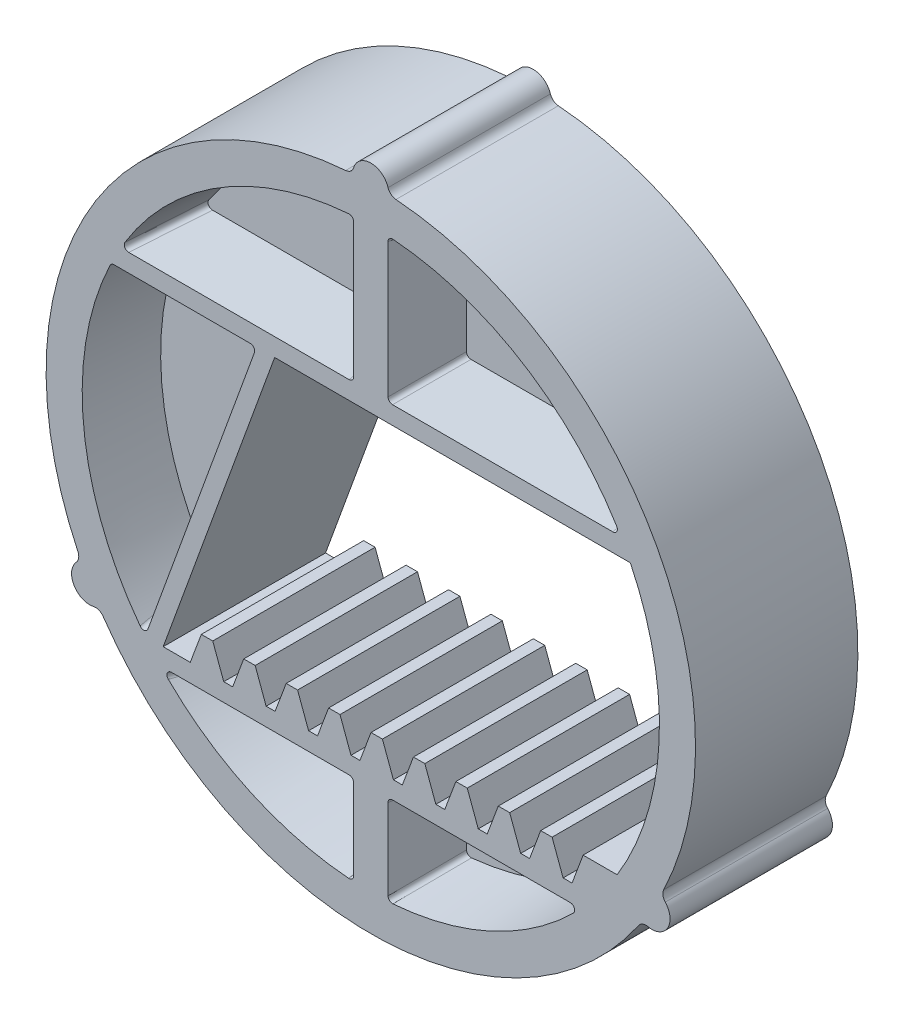
from build123d import *

# Parameters (mm, degrees)
BOSS_EXTRU_1_DEPTH                = 9
ENL_V_MAT_EXTRU_1_DEPTH           = 4
ENL_V_MAT_EXTRU_1_DRAFT           = -5
ENL_V_MAT_EXTRU_1_PROFILE_2_DEPTH = 4
ENL_V_MAT_EXTRU_1_PROFILE_2_DRAFT = -5
ENL_V_MAT_EXTRU_1_PROFILE_3_DEPTH = 4
ENL_V_MAT_EXTRU_1_PROFILE_3_DRAFT = -5
ENL_V_MAT_EXTRU_1_PROFILE_4_DEPTH = 4
ENL_V_MAT_EXTRU_1_PROFILE_4_DRAFT = -5
ENL_V_MAT_EXTRU_1_PROFILE_5_DEPTH = 4
ENL_V_MAT_EXTRU_1_PROFILE_5_DRAFT = -5
CONG_1_R                          = 0.25


with BuildPart() as part:
    # Esquisse1 → Boss.-Extru.1 (new body)
    with BuildSketch(Plane.XY):
        with BuildLine():
            ThreePointArc((-15.367509352, -9.975285609), (-15.074622025, -9.9973907), (-14.844683086, -10.180146564))
            ThreePointArc((-14.844683086, -10.180146564), (0, -18), (14.844683086, -10.180146564))
            ThreePointArc((14.844683086, -10.180146564), (15.074622025, -9.9973907), (15.367509352, -9.975285609))
            ThreePointArc((15.367509352, -9.975285609), (16.454482672, -9.5), (16.322605423, -8.321010688))
            ThreePointArc((16.322605423, -8.321010688), (16.19530533, -8.056310276), (16.238607082, -7.765799382))
            ThreePointArc((16.238607082, -7.765799382), (15.588457268, 9), (1.393923995, 17.945945946))
            ThreePointArc((1.393923995, 17.945945946), (1.120683305, 18.053700976), (0.955096071, 18.296296296))
            ThreePointArc((0.955096071, 18.296296296), (0, 19), (-0.955096071, 18.296296296))
            ThreePointArc((-0.955096071, 18.296296296), (-1.120683305, 18.053700976), (-1.393923995, 17.945945946))
            ThreePointArc((-1.393923995, 17.945945946), (-15.588457268, 9), (-16.238607082, -7.765799382))
            ThreePointArc((-16.238607082, -7.765799382), (-16.19530533, -8.056310276), (-16.322605423, -8.321010688))
            ThreePointArc((-16.322605423, -8.321010688), (-16.454482672, -9.5), (-15.367509352, -9.975285609))
        make_face()
        with BuildLine():
            Line((-5.331244604, 7), (14.38749457, 7))
            ThreePointArc((14.38749457, 7), (15.981739721, -0.764195974), (13.653943789, -8.340852415))
            Line((13.653943789, -8.340852415), (11.768206401, -8.340852415))
            Line((11.768206401, -8.340852415), (11.154006631, -9.990852415))
            Line((11.154006631, -9.990852415), (10.658353575, -9.990852415))
            Line((10.658353575, -9.990852415), (10.048820527, -8.33912277))
            Line((10.048820527, -8.33912277), (9.416678633, -8.33912277))
            Line((9.416678633, -8.33912277), (8.802478863, -9.98912277))
            Line((8.802478863, -9.98912277), (8.306825807, -9.98912277))
            Line((8.306825807, -9.98912277), (7.697292758, -8.337393125))
            Line((7.697292758, -8.337393125), (7.065150865, -8.337393125))
            Line((7.065150865, -8.337393125), (6.450951094, -9.987393125))
            Line((6.450951094, -9.987393125), (5.955298038, -9.987393125))
            Line((5.955298038, -9.987393125), (5.34576499, -8.33566348))
            Line((5.34576499, -8.33566348), (4.713623096, -8.33566348))
            Line((4.713623096, -8.33566348), (4.099423326, -9.98566348))
            Line((4.099423326, -9.98566348), (3.60377027, -9.98566348))
            Line((3.60377027, -9.98566348), (2.994237222, -8.333933835))
            Line((2.994237222, -8.333933835), (2.362095328, -8.333933835))
            Line((2.362095328, -8.333933835), (1.747895558, -9.983933835))
            Line((1.747895558, -9.983933835), (1.252242502, -9.983933835))
            Line((1.252242502, -9.983933835), (0.642709453, -8.332204189))
            Line((0.642709453, -8.332204189), (0.01056756, -8.332204189))
            Line((0.01056756, -8.332204189), (-0.603632211, -9.982204189))
            Line((-0.603632211, -9.982204189), (-1.099285266, -9.982204189))
            Line((-1.099285266, -9.982204189), (-1.708818315, -8.330474544))
            Line((-1.708818315, -8.330474544), (-2.340960209, -8.330474544))
            Line((-2.340960209, -8.330474544), (-2.955159979, -9.980474544))
            Line((-2.955159979, -9.980474544), (-3.450813035, -9.980474544))
            Line((-3.450813035, -9.980474544), (-4.060346083, -8.328744899))
            Line((-4.060346083, -8.328744899), (-4.692487977, -8.328744899))
            Line((-4.692487977, -8.328744899), (-5.306687747, -9.978744899))
            Line((-5.306687747, -9.978744899), (-5.802340803, -9.978744899))
            Line((-5.802340803, -9.978744899), (-6.411873851, -8.327015254))
            Line((-6.411873851, -8.327015254), (-7.044015745, -8.327015254))
            Line((-7.044015745, -8.327015254), (-7.658215515, -9.977015254))
            Line((-7.658215515, -9.977015254), (-8.153868571, -9.977015254))
            Line((-8.153868571, -9.977015254), (-8.76340162, -8.325285609))
            Line((-8.76340162, -8.325285609), (-9.395543513, -8.325285609))
            Line((-9.395543513, -8.325285609), (-10.009743284, -9.975285609))
            Line((-10.009743284, -9.975285609), (-11.509743284, -9.975285609))
            Line((-11.509743284, -9.975285609), (-5.331244604, 7))
        make_face(mode=Mode.SUBTRACT)
    extrude(amount=BOSS_EXTRU_1_DEPTH)


with BuildPart() as enl_v_mat_extru_1_tool:
    # Esquisse2 → Enlèv. mat.-Extru.1 (with draft: the straight prism first)
    with BuildSketch(Plane.XY.offset(9)):
        with BuildLine():
            Line((-6.331244604, 7), (-14.38749457, 7))
            ThreePointArc((-14.38749457, 7), (-15.903000705, -1.759138592), (-12.509743284, -9.975285609))
            Line((-12.509743284, -9.975285609), (-6.331244604, 7))
        make_face()
    extrude(amount=-ENL_V_MAT_EXTRU_1_DEPTH)
    # Enlèv. mat.-Extru.1: the draft: its side faces are tilted about the plane it starts from
    enl_v_mat_extru_1_sides = [enl_v_mat_extru_1_tool.faces().sort_by_distance(p)[0] for p in [
        (-9.420493944, -1.487642804, 7),
        (-10.359369587, 7, 7),
        (-15.903000705, -1.759138592, 7),
    ]]
    draft(enl_v_mat_extru_1_sides, Plane.XY.offset(9), ENL_V_MAT_EXTRU_1_DRAFT)


with BuildPart() as part_1:
    add(part.part)

    # Enlèv. mat.-Extru.1: cut by enl_v_mat_extru_1_tool
    add(enl_v_mat_extru_1_tool.part, mode=Mode.SUBTRACT)


with BuildPart() as enl_v_mat_extru_1_profile_2_tool:
    # Esquisse2 → Enlèv. mat.-Extru.1 profile 2 (with draft: the straight prism first)
    with BuildSketch(Plane.XY.offset(9)):
        with BuildLine():
            ThreePointArc((-0.955096071, 15.971468044), (-8.410185938, 13.611347196), (-13.856406461, 8))
            Line((-13.856406461, 8), (-0.955096071, 8))
            Line((-0.955096071, 8), (-0.955096071, 15.971468044))
        make_face()
    extrude(amount=-ENL_V_MAT_EXTRU_1_PROFILE_2_DEPTH)
    # Enlèv. mat.-Extru.1 profile 2: the draft: its side faces are tilted about the plane it starts from
    enl_v_mat_extru_1_profile_2_sides = [enl_v_mat_extru_1_profile_2_tool.faces().sort_by_distance(p)[0] for p in [
        (-8.410185938, 13.611347196, 7),
        (-7.405751266, 8, 7),
        (-0.955096071, 11.985734022, 7),
    ]]
    draft(enl_v_mat_extru_1_profile_2_sides, Plane.XY.offset(9), ENL_V_MAT_EXTRU_1_PROFILE_2_DRAFT)


with BuildPart() as part_2:
    add(part_1.part)

    # Enlèv. mat.-Extru.1 profile 2: cut by enl_v_mat_extru_1_profile_2_tool
    add(enl_v_mat_extru_1_profile_2_tool.part, mode=Mode.SUBTRACT)


with BuildPart() as enl_v_mat_extru_1_profile_3_tool:
    # Esquisse2 → Enlèv. mat.-Extru.1 profile 3 (with draft: the straight prism first)
    with BuildSketch(Plane.XY.offset(9)):
        with BuildLine():
            Line((0.955096071, 15.971468044), (0.955096071, 8))
            Line((0.955096071, 8), (13.856406461, 8))
            ThreePointArc((13.856406461, 8), (8.410185938, 13.611347196), (0.955096071, 15.971468044))
        make_face()
    extrude(amount=-ENL_V_MAT_EXTRU_1_PROFILE_3_DEPTH)
    # Enlèv. mat.-Extru.1 profile 3: the draft: its side faces are tilted about the plane it starts from
    enl_v_mat_extru_1_profile_3_sides = [enl_v_mat_extru_1_profile_3_tool.faces().sort_by_distance(p)[0] for p in [
        (0.955096071, 11.985734022, 7),
        (7.405751266, 8, 7),
        (8.410185938, 13.611347196, 7),
    ]]
    draft(enl_v_mat_extru_1_profile_3_sides, Plane.XY.offset(9), ENL_V_MAT_EXTRU_1_PROFILE_3_DRAFT)


with BuildPart() as part_3:
    add(part_2.part)

    # Enlèv. mat.-Extru.1 profile 3: cut by enl_v_mat_extru_1_profile_3_tool
    add(enl_v_mat_extru_1_profile_3_tool.part, mode=Mode.SUBTRACT)


with BuildPart() as enl_v_mat_extru_1_profile_4_tool:
    # Esquisse2 → Enlèv. mat.-Extru.1 profile 4 (with draft: the straight prism first)
    with BuildSketch(Plane.XY.offset(9)):
        with BuildLine():
            ThreePointArc((-11.642298133, -10.975285609), (-6.775990327, -14.494342175), (-0.955096071, -15.971468044))
            Line((-0.955096071, -15.971468044), (-0.955096071, -10.975285609))
            Line((-0.955096071, -10.975285609), (-11.642298133, -10.975285609))
        make_face()
    extrude(amount=-ENL_V_MAT_EXTRU_1_PROFILE_4_DEPTH)
    # Enlèv. mat.-Extru.1 profile 4: the draft: its side faces are tilted about the plane it starts from
    enl_v_mat_extru_1_profile_4_sides = [enl_v_mat_extru_1_profile_4_tool.faces().sort_by_distance(p)[0] for p in [
        (-6.775990327, -14.494342175, 7),
        (-0.955096071, -13.473376827, 7),
        (-6.298697102, -10.975285609, 7),
    ]]
    draft(enl_v_mat_extru_1_profile_4_sides, Plane.XY.offset(9), ENL_V_MAT_EXTRU_1_PROFILE_4_DRAFT)


with BuildPart() as part_4:
    add(part_3.part)

    # Enlèv. mat.-Extru.1 profile 4: cut by enl_v_mat_extru_1_profile_4_tool
    add(enl_v_mat_extru_1_profile_4_tool.part, mode=Mode.SUBTRACT)


with BuildPart() as enl_v_mat_extru_1_profile_5_tool:
    # Esquisse2 → Enlèv. mat.-Extru.1 profile 5 (with draft: the straight prism first)
    with BuildSketch(Plane.XY.offset(9)):
        with BuildLine():
            ThreePointArc((0.955096071, -15.971468044), (6.775990327, -14.494342175), (11.642298133, -10.975285609))
            Line((11.642298133, -10.975285609), (0.955096071, -10.975285609))
            Line((0.955096071, -10.975285609), (0.955096071, -15.971468044))
        make_face()
    extrude(amount=-ENL_V_MAT_EXTRU_1_PROFILE_5_DEPTH)
    # Enlèv. mat.-Extru.1 profile 5: the draft: its side faces are tilted about the plane it starts from
    enl_v_mat_extru_1_profile_5_sides = [enl_v_mat_extru_1_profile_5_tool.faces().sort_by_distance(p)[0] for p in [
        (6.775990327, -14.494342175, 7),
        (6.298697102, -10.975285609, 7),
        (0.955096071, -13.473376827, 7),
    ]]
    draft(enl_v_mat_extru_1_profile_5_sides, Plane.XY.offset(9), ENL_V_MAT_EXTRU_1_PROFILE_5_DRAFT)


with BuildPart() as part_5:
    add(part_4.part)

    # Enlèv. mat.-Extru.1 profile 5: cut by enl_v_mat_extru_1_profile_5_tool
    add(enl_v_mat_extru_1_profile_5_tool.part, mode=Mode.SUBTRACT)

    # Congé1
    cong_1_edges = [part_5.edges().sort_by_distance(p)[0] for p in [
        (1.130082452, -15.784611801, 6.999896517),
        (1.130073398, -11.150262936, 7),
        (11.229227033, -11.150400827, 6.998423898),
        (-1.130082452, -15.784611801, 6.999896517),
        (-11.229227033, -11.150400827, 6.998423898),
        (-1.130073398, -11.150262936, 7),
        (-12.566224701, -9.618716164, 6.999408194),
        (-14.277617851, 6.825020639, 6.99997675),
        (-6.581138125, 6.825022673, 7),
        (13.549865322, 8.175023953, 6.99946706),
        (1.130082452, 15.784611801, 6.999896517),
        (1.130073398, 8.174977327, 7),
        (-1.130073398, 8.174977327, 7),
        (-1.130082452, 15.784611801, 6.999896517),
        (-13.549865322, 8.175023953, 6.99946706),
    ]]
    fillet(cong_1_edges, radius=CONG_1_R)


solid = part_5.part
